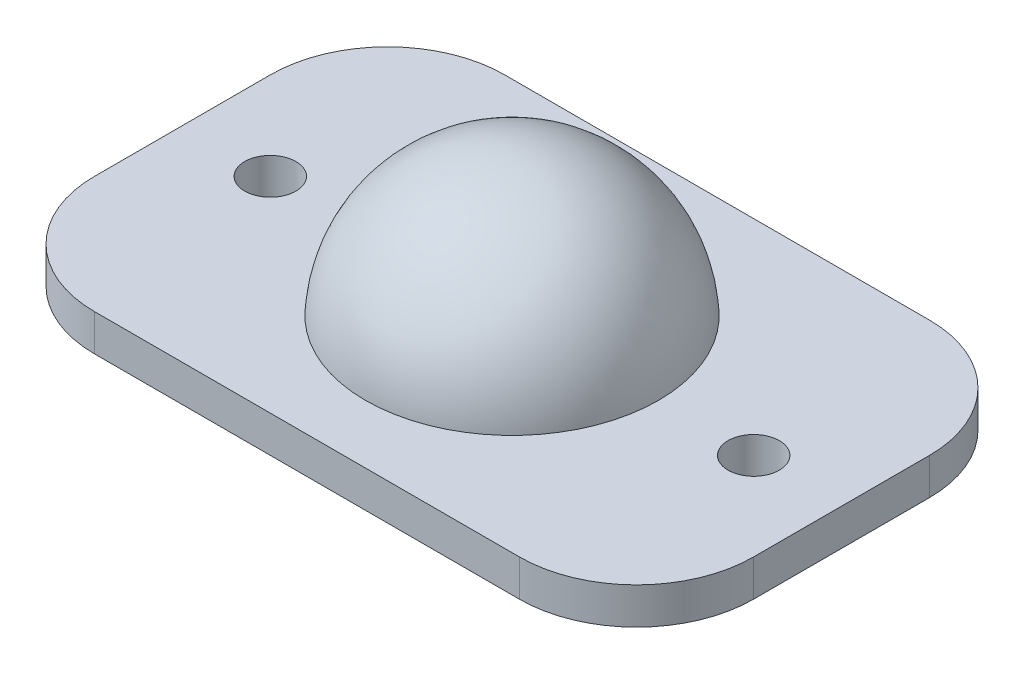
from build123d import *

# Parameters (mm, degrees)
SKETCH1_R           = 1.75
BOSS_EXTRUDE1_DEPTH = 1.25
SKETCH2_R           = 10
BOSS_EXTRUDE2_DEPTH = 9.5
FILLET1_R           = 10


with BuildPart() as part:
    # Sketch1 → Boss-Extrude1 (new, symmetric)
    with BuildSketch(Plane(origin=(0, 0, 0), x_dir=(1, 0, 0), z_dir=(0, 1, 0))):
        with BuildLine():
            Line((-14.5, -14), (14.5, -14))
            ThreePointArc((14.5, -14), (20.156854249, -11.656854249), (22.5, -6))
            Line((22.5, -6), (22.5, 6))
            ThreePointArc((22.5, 6), (20.156854249, 11.656854249), (14.5, 14))
            Line((14.5, 14), (-14.5, 14))
            ThreePointArc((-14.5, 14), (-20.156854249, 11.656854249), (-22.5, 6))
            Line((-22.5, 6), (-22.5, -6))
            ThreePointArc((-22.5, -6), (-20.156854249, -11.656854249), (-14.5, -14))
        make_face()
        with Locations(Location((16.5, 0, 0), (0, 0, 270))):
            Circle(SKETCH1_R, mode=Mode.SUBTRACT)
        with Locations(Location((-16.5, 0, 0), (0, 0, 270))):
            Circle(SKETCH1_R, mode=Mode.SUBTRACT)
    extrude(amount=BOSS_EXTRUDE1_DEPTH, both=True)

    # Sketch2 → Boss-Extrude2 (add)
    with BuildSketch(Plane(origin=(0, 1.25, 0), x_dir=(1, 0, 0), z_dir=(0, 1, 0))):
        with Locations(Location((0, 0, 0), (0, 0, 270))):
            Circle(SKETCH2_R)
    extrude(amount=BOSS_EXTRUDE2_DEPTH)

    # Fillet1
    # the kernel refuses this fillet: 10 mm, written as the material it takes off along each edge
    with BuildSketch(Plane(origin=(0, 10.75, 0), x_dir=(0, 0, 1), z_dir=(-1, 0, 0))) as fillet1_piece_1:
        with BuildLine():
            CenterArc((0.012507822, -10), FILLET1_R, 2.865983983, 87.134016017)
            Line((0.012507822, 0), (0.012507822, 0.2))
            Line((0.012507822, 0.2), (10, 0.2))
            Line((10, 0.2), (10.2, 0))
            ThreePointArc((10.2, 0), (10.2, -4.75), (10.199749844, -9.49))
            Line((10.199749844, -9.49), (10, -9.5))
        make_face()
    revolve(axis=Axis((0, 10.75, 0), (0, 1, 0)), mode=Mode.SUBTRACT)


solid = part.part
